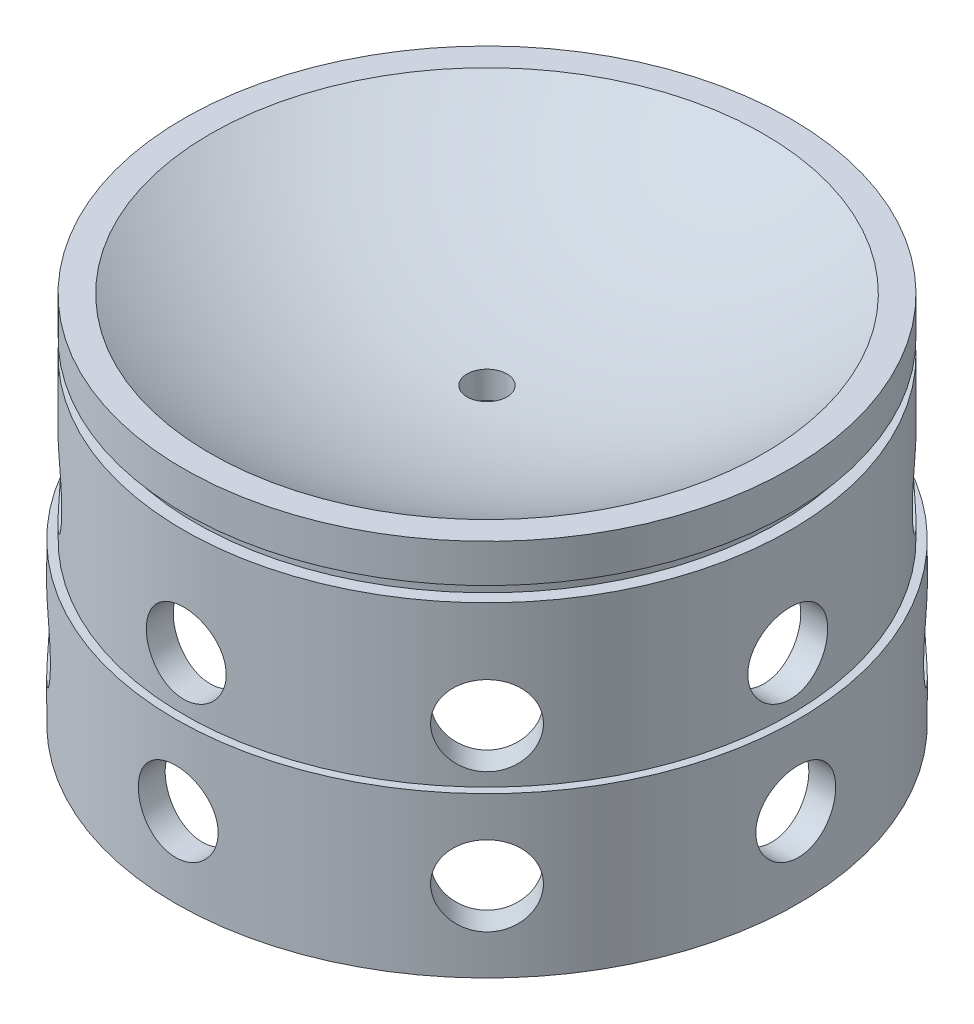
from build123d import *

# Parameters (mm, degrees)
MAIN_LINE_HOLE_REACH      = 124.767
MAIN_LINE_HOLE_END_RADIUS = 123.994333333
SKETCH10_R                = 4.7625
CHAMFER1_SIZE             = 2.54
SCALE1_SCALE              = 0.5
CIRPATTERN1_COUNT         = 8


with BuildPart() as part:
    # Sketch1 → Revolve1 (revolve)
    with BuildSketch(Plane.XY, mode=Mode.PRIVATE) as revolve1_sk:
        with BuildLine():
            Line((0, 6.35), (0, 0))
            Line((0, 0), (66.04, 0))
            Line((66.04, 0), (72.39, 0))
            Line((72.39, 0), (72.39, 12.7))
            Line((72.39, 12.7), (69.469, 12.7))
            Line((69.469, 12.7), (69.469, 16.256))
            Line((69.469, 16.256), (72.39, 16.256))
            Line((72.39, 16.256), (72.39, 25.4))
            Line((72.39, 25.4), (66.04, 25.4))
            ThreePointArc((66.04, 25.4), (34.366350184, 11.207652694), (0, 6.35))
        make_face()
        Polygon((72.39, 0), (66.04, 0), (66.04, -25.4), (67.945, -25.4), (72.39, -25.4), align=None)
        Polygon((74.295, -25.4), (72.39, -25.4), (67.945, -25.4), (67.945, -63.5), (74.295, -63.5), align=None)
    revolve(revolve1_sk.sketch.rotate(Axis((0, 0, 0), (0, 1, 0)), 90), axis=Axis((0, 0, 0), (0, 1, 0)))

    # Main Line Hole: up to this sphere (the profile starts outside it)
    main_line_hole_end = Location((0, 130.344333333, 0)) * Sphere(MAIN_LINE_HOLE_END_RADIUS, mode=Mode.PRIVATE)
    # Sketch10 → Main Line Hole (cut, up to the surface)
    with BuildSketch(Plane.XZ, mode=Mode.PRIVATE) as main_line_hole_sk1:
        with Locations(Location((0, 0, 0), (0, 0, 270))):
            Circle(SKETCH10_R)
    main_line_hole_tool1 = extrude(main_line_hole_sk1.sketch, amount=-MAIN_LINE_HOLE_REACH, mode=Mode.PRIVATE) - main_line_hole_end
    add(main_line_hole_tool1.solids().sort_by_distance((0, 0, 0))[0], mode=Mode.SUBTRACT)

    # Chamfer1
    # the kernel refuses this chamfer: 2.54 mm, written as the material it adds along each edge
    with BuildSketch(Plane(origin=(0, -25.4, 0), x_dir=(0, 0, -1), z_dir=(1, 0, 0))) as chamfer1_piece_1_section:
        Polygon((67.945 - CHAMFER1_SIZE, 0), (67.945, -CHAMFER1_SIZE), (67.945, 0), align=None)
    chamfer1_piece_1 = revolve(axis=Axis((0, -25.4, 0), (0, 1, 0)), mode=Mode.PRIVATE)
    chamfer1_piece_1 = chamfer1_piece_1 - Plane(origin=(0, -26.944579126, 0), x_dir=(0, 0, -1), z_dir=(0, -1, 0)) * Cylinder(66.04, 272, mode=Mode.PRIVATE)
    add(chamfer1_piece_1)


with BuildPart() as part_1:
    # Scale1: scaled about (0, -6.61182783, 0)
    add(part.part.scale(SCALE1_SCALE).moved(Location((0, -3.305913915, 0))))

    # Sketch9 → 3/8 (0.375) Diameter Hole2 (revolve, cut)
    with BuildSketch(Plane(origin=(37.1475, -25.530913915, 0), x_dir=(0, 0, -1), z_dir=(0, 1, 0))):
        Polygon((0, 0), (0, 40.008098698), (4.7625, 37.1465), (4.7625, 0), align=None)
    f_3_8_0_375_diameter_hole2 = revolve(axis=Axis((43.4975, -25.530913915, 0), (-1, 0, 0)), mode=Mode.SUBTRACT)

    # Sketch8 → 3/8 (0.375) Diameter Hole1 (revolve, cut)
    with BuildSketch(Plane(origin=(36.195, -9.655913915, 0), x_dir=(0, 0, -1), z_dir=(0, 1, 0))):
        Polygon((0, 0), (0, 39.055598698), (4.7625, 36.194), (4.7625, 0), align=None)
    f_3_8_0_375_diameter_hole1 = revolve(axis=Axis((42.545, -9.655913915, 0), (-1, 0, 0)), mode=Mode.SUBTRACT)

    # CirPattern1: 3/8 (0.375) Diameter Hole2, 3/8 (0.375) Diameter Hole1 ×8 about axis
    cirpattern1_axis = Axis((0, -16.005913915, 0), (0, -1, 0))
    add([f_3_8_0_375_diameter_hole2.rotate(cirpattern1_axis, i * 360 / CIRPATTERN1_COUNT) for i in range(1, CIRPATTERN1_COUNT)], mode=Mode.SUBTRACT)
    add([f_3_8_0_375_diameter_hole1.rotate(cirpattern1_axis, i * 360 / CIRPATTERN1_COUNT) for i in range(1, CIRPATTERN1_COUNT)], mode=Mode.SUBTRACT)


solid = part_1.part
